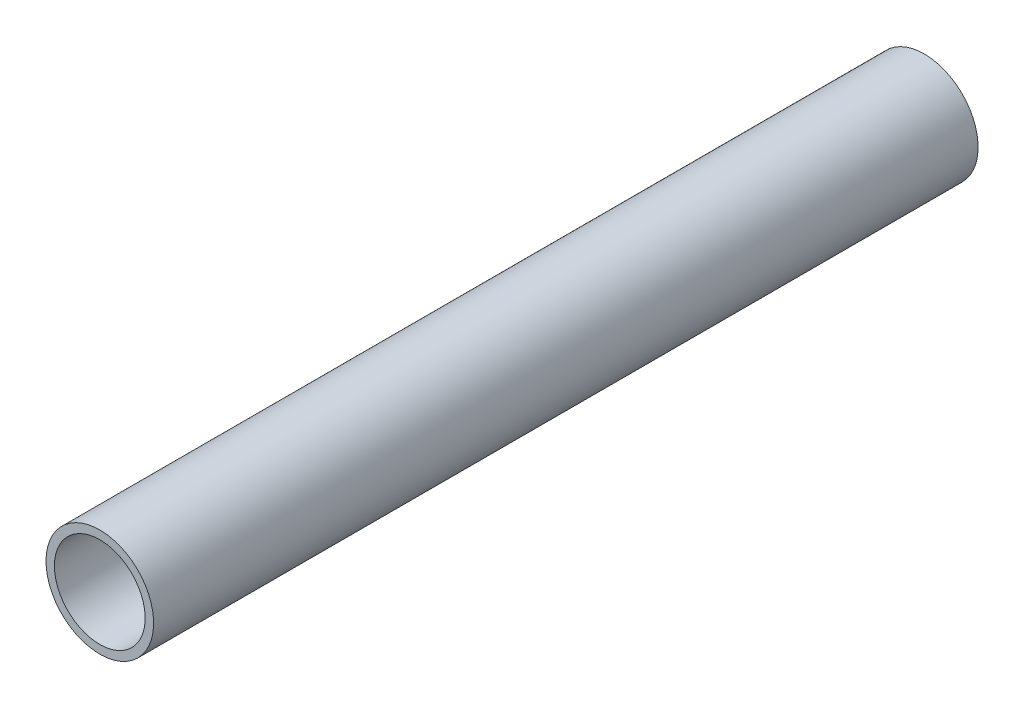
from build123d import *

# Parameters (mm, degrees)
SKETCH3_R           = 7.9375
SKETCH3_R_2         = 6.6929
BOSS_EXTRUDE1_DEPTH = 60.815232065


with BuildPart() as part:
    # Sketch3 → Boss-Extrude1 (new, symmetric)
    with BuildSketch(Plane.XY):
        Circle(SKETCH3_R)
        Circle(SKETCH3_R_2, mode=Mode.SUBTRACT)
    extrude(amount=BOSS_EXTRUDE1_DEPTH, both=True)


solid = part.part
